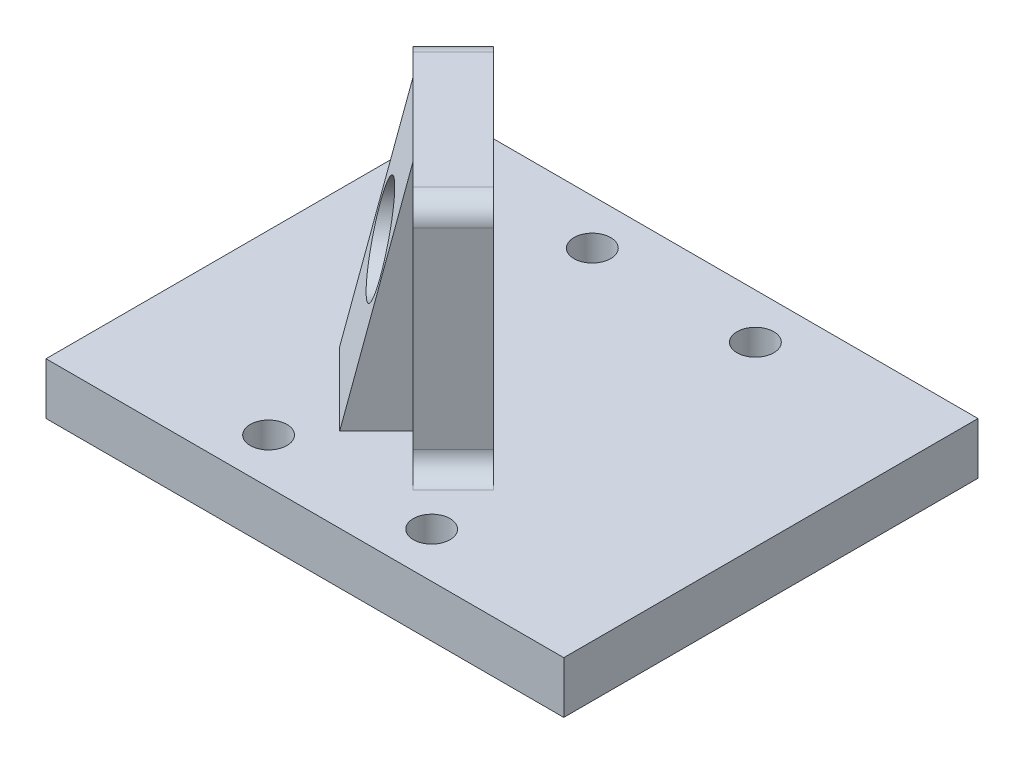
from build123d import *

# Parameters (mm, degrees)
SKETCH1_W           = 63.5
SKETCH1_H           = 50.8
BOSS_EXTRUDE1_DEPTH = 6.35
BOSS_EXTRUDE2_DEPTH = 28.575
SKETCH4_R           = 2.25
CUT_EXTRUDE2_DEPTH  = 50.6966108
FILLET1_R           = 2.54
SKETCH5_R           = 2.413
CUT_EXTRUDE3_DEPTH  = 55.806967537
BOSS_EXTRUDE3_DEPTH = 6.35
SKETCH7_R           = 5.588
CUT_EXTRUDE4_DEPTH  = 61.338925607


with BuildPart() as part:
    # Sketch1 → Boss-Extrude1 (new body)
    with BuildSketch(Plane(origin=(0, 0, 0), x_dir=(1, 0, 0), z_dir=(0, 1, 0))):
        Rectangle(SKETCH1_W, SKETCH1_H)
    extrude(amount=BOSS_EXTRUDE1_DEPTH)

    # Sketch2 → Boss-Extrude2 (add)
    with BuildSketch(Plane(origin=(0, 6.35, 0), x_dir=(1, 0, 0), z_dir=(0, 1, 0))):
        Polygon((2.907968577, -15.052543666), (-15.052543666, 2.907968577), (-10.102788136, 7.857724106), (7.857724106, -10.102788136), align=None)
    extrude(amount=BOSS_EXTRUDE2_DEPTH)

    # Sketch4 → Cut-Extrude2 (cut, through all)
    with BuildSketch(Plane(origin=(0, 6.35, 0), x_dir=(1, 0, 0), z_dir=(0, 1, 0))):
        with Locations((10, -19.85)):
            Circle(SKETCH4_R)
        with Locations((10, 19.85)):
            Circle(SKETCH4_R)
        with Locations((-10, 19.85)):
            Circle(SKETCH4_R)
        with Locations((-10, -19.85)):
            Circle(SKETCH4_R)
    extrude(amount=-CUT_EXTRUDE2_DEPTH, mode=Mode.SUBTRACT)

    # Fillet1
    fillet1_edges = [part.edges().sort_by_distance(p)[0] for p in [
        (-12.577665901, 6.35, -5.382846341),
        (-12.577665901, 34.925, -5.382846341),
        (5.382846341, 34.925, 12.577665901),
        (5.382846341, 6.35, 12.577665901),
    ]]
    fillet(fillet1_edges, radius=FILLET1_R)

    # Sketch5 → Cut-Extrude3 (cut, through all)
    with BuildSketch(Plane(origin=(-1.122532015, 0, 1.122532015), x_dir=(-0.7071067811865462, 0, -0.7071067811865488), z_dir=(0.7071067811865488, 0, -0.7071067811865462))):
        with Locations((0, 22.225)):
            Circle(SKETCH5_R)
    extrude(amount=-CUT_EXTRUDE3_DEPTH, mode=Mode.SUBTRACT)

    # Sketch6 → Boss-Extrude3 (add, symmetric)
    with BuildSketch(Plane(origin=(0, 0, 0), x_dir=(-0.707106781186549, 0, 0.7071067811865461), z_dir=(-0.7071067811865461, 0, -0.707106781186549))):
        Polygon((8.5875114, 34.925), (14.9375114, 6.35), (8.5875114, 6.35), align=None)
    extrude(amount=BOSS_EXTRUDE3_DEPTH, both=True)

    # Sketch7 → Cut-Extrude4 (cut, through all)
    with BuildSketch(Plane(origin=(-6.072287544, 0, 6.072287544), x_dir=(0.7071067811865464, 0, 0.7071067811865488), z_dir=(-0.7071067811865488, 0, 0.7071067811865464))):
        with Locations((0, 22.225)):
            Circle(SKETCH7_R)
    extrude(amount=CUT_EXTRUDE4_DEPTH, mode=Mode.SUBTRACT)


solid = part.part
